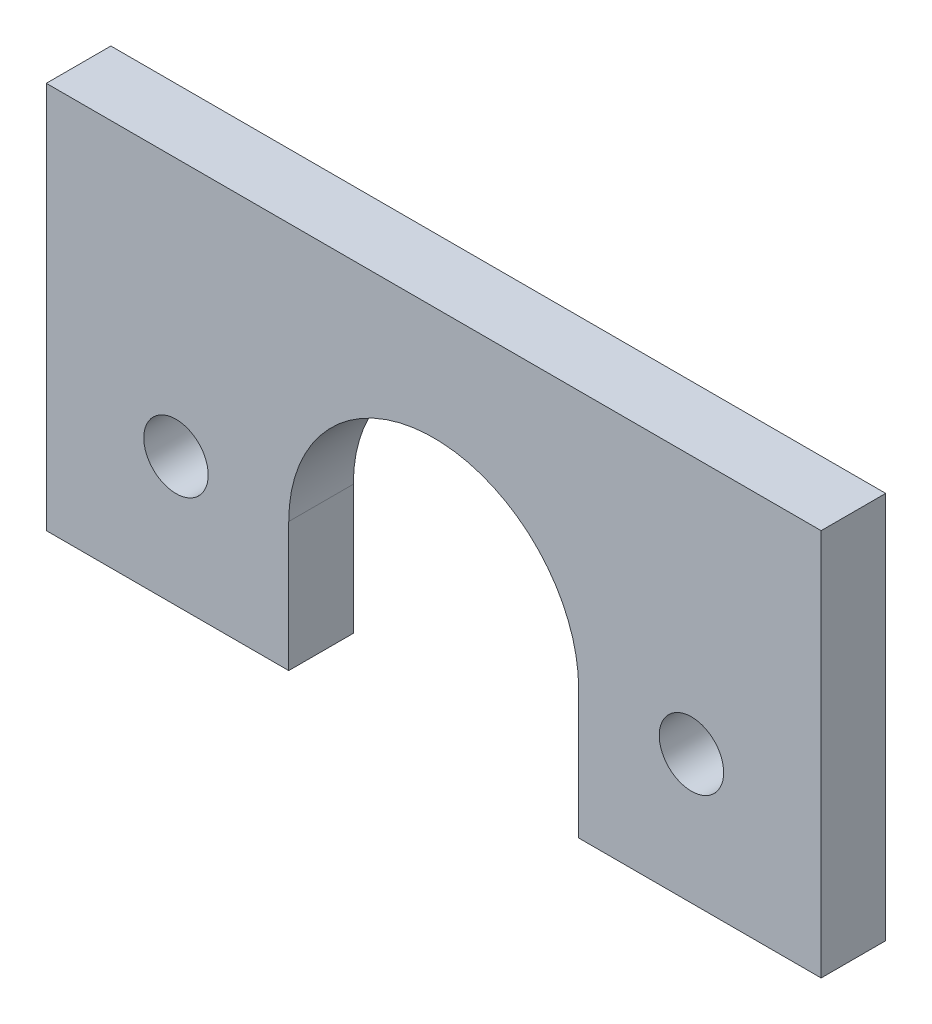
from build123d import *

# Parameters (mm, degrees)
SKETCH1_R           = 3.168199077
BOSS_EXTRUDE1_DEPTH = 6.35


with BuildPart() as part:
    # Sketch1 → Boss-Extrude1 (new body)
    with BuildSketch(Plane.XY):
        with BuildLine():
            Line((-14.256895846, -12.450216129), (-14.256895846, 0.249783871))
            ThreePointArc((-14.256895846, 0.249783871), (0, 14.506679717), (14.256895846, 0.249783871))
            Line((14.256895846, 0.249783871), (14.256895846, -12.450216129))
            Line((14.256895846, -12.450216129), (38.1, -12.450216129))
            Line((38.1, -12.450216129), (38.1, 25.649783871))
            Line((38.1, 25.649783871), (-38.1, 25.649783871))
            Line((-38.1, 25.649783871), (-38.1, -12.450216129))
            Line((-38.1, -12.450216129), (-14.256895846, -12.450216129))
        make_face()
        with Locations((-25.345592616, 0.249783871)):
            Circle(SKETCH1_R, mode=Mode.SUBTRACT)
        with Locations((25.345592616, 0.249783871)):
            Circle(SKETCH1_R, mode=Mode.SUBTRACT)
    extrude(amount=BOSS_EXTRUDE1_DEPTH)


solid = part.part
